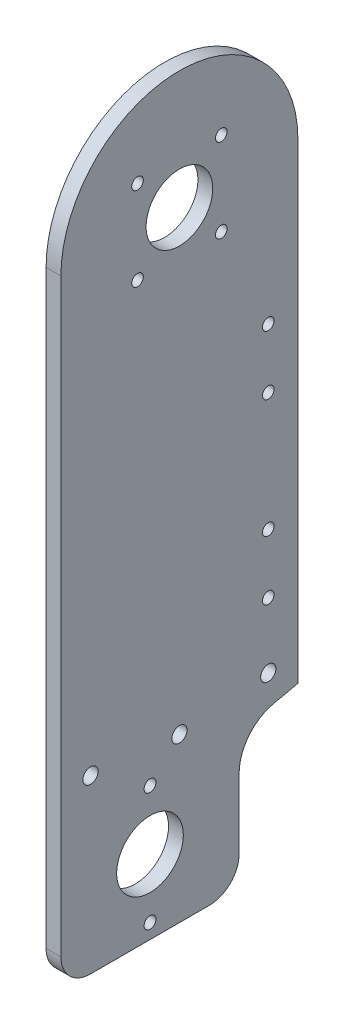
from build123d import *

# Parameters (mm, degrees)
SKETCH1_R                           = 14.2875
BOSS_EXTRUDE1_DEPTH                 = 6.35
F_0_257_DIAMETER_HOLE1_D            = 6.5278
F_9_0_2_DIAMETER_HOLE1_D            = 5.08
FILLET2_R                           = 12.7
FILLET1_R                           = 19.05
F_9_0_196_DIAMETER_HOLE1_AT_2_COUNT = 2
F_9_0_196_DIAMETER_HOLE1_AT_2_PITCH = 25.4
F_9_0_196_DIAMETER_HOLE1_AT_3_COUNT = 2
F_9_0_196_DIAMETER_HOLE1_AT_3_PITCH = 76.2
F_9_0_196_DIAMETER_HOLE1_AT_4_COUNT = 2
F_9_0_196_DIAMETER_HOLE1_AT_4_PITCH = 101.6
F_9_0_196_DIAMETER_HOLE2_OUTLINE_R  = 2.4892
F_9_0_196_DIAMETER_HOLE2_DEPTH      = 6.35


# Read off the part's stored shape, not the designer's step: #9 (0.196) Diameter Hole2
with BuildPart() as part:
    # Sketch1 → Boss-Extrude1 (new body)
    with BuildSketch(Plane.YZ):
        with BuildLine():
            Line((0, -50.8), (-201.989896777, -50.8))
            ThreePointArc((-201.989896777, -50.8), (-204.733971085, -38.269563411), (-206.701492618, -25.593970963))
            Line((-206.701492618, -25.593970963), (-265.489896777, -25.593970963))
            Line((-265.489896777, -25.593970963), (-265.489896777, 50.8))
            Line((-265.489896777, 50.8), (-201.989896777, 50.8))
            Line((-201.989896777, 50.8), (0, 50.8))
            ThreePointArc((0, 50.8), (50.8, 0), (0, -50.8))
        make_face()
        with Locations(Location((0, 0, 0), (0, 0, 270))):
            Circle(SKETCH1_R, mode=Mode.SUBTRACT)
        with Locations(Location((-233.739896777, 12.603014519, 0), (0, 0, 270))):
            Circle(SKETCH1_R, mode=Mode.SUBTRACT)
    extrude(amount=BOSS_EXTRUDE1_DEPTH)

    # F (0.257) Diameter Hole1 (through all)
    with Locations(Plane.YZ.offset(6.35)):
        with Locations((0, 0), (-191.833069099, -38.1), (-195.58, 0), (-191.833069099, 38.1)):
            Hole(F_0_257_DIAMETER_HOLE1_D / 2)

    # #9 (0.2) Diameter Hole1 (through all)
    with Locations(Plane.YZ.offset(6.35)):
        with Locations((-259.139896777, 12.603014519), (-208.339896777, 12.603014519)):
            Hole(F_9_0_2_DIAMETER_HOLE1_D / 2)

    # Fillet2
    fillet2_edges = [part.edges().sort_by_distance(p)[0] for p in [
        (3.175, -265.489896777, -25.593970963),
        (3.175, -265.489896777, 50.8),
    ]]
    fillet(fillet2_edges, radius=FILLET2_R)

    # Fillet1
    fillet1_edges = [part.edges().sort_by_distance(p)[0] for p in [
        (3.175, -206.701492618, -25.593970963),
    ]]
    fillet(fillet1_edges, radius=FILLET1_R)

    # Sketch9 → #9 (0.196) Diameter Hole1 (revolve, cut)
    with BuildSketch(Plane(origin=(6.35, -163.889896777, -38.1), x_dir=(0, 0, -1), z_dir=(0, 1, 0))):
        Polygon((0, 0), (0, 6.35), (4.7625, 6.35), (2.4892, 4.0767), (2.4892, 0), align=None)
    f_9_0_196_diameter_hole1 = revolve(axis=Axis((12.7, -163.889896777, -38.1), (-1, 0, 0)), mode=Mode.SUBTRACT)

    # #9 (0.196) Diameter Hole1 at 2: #9 (0.196) Diameter Hole1 ×2
    with Locations(*[(0, i * F_9_0_196_DIAMETER_HOLE1_AT_2_PITCH, 0) for i in range(1, F_9_0_196_DIAMETER_HOLE1_AT_2_COUNT)]):
        add(f_9_0_196_diameter_hole1, mode=Mode.SUBTRACT)

    # #9 (0.196) Diameter Hole1 at 3: #9 (0.196) Diameter Hole1 ×2
    with Locations(*[(0, i * F_9_0_196_DIAMETER_HOLE1_AT_3_PITCH, 0) for i in range(1, F_9_0_196_DIAMETER_HOLE1_AT_3_COUNT)]):
        add(f_9_0_196_diameter_hole1, mode=Mode.SUBTRACT)

    # #9 (0.196) Diameter Hole1 at 4: #9 (0.196) Diameter Hole1 ×2
    with Locations(*[(0, i * F_9_0_196_DIAMETER_HOLE1_AT_4_PITCH, 0) for i in range(1, F_9_0_196_DIAMETER_HOLE1_AT_4_COUNT)]):
        add(f_9_0_196_diameter_hole1, mode=Mode.SUBTRACT)

    # #9 (0.196) Diameter Hole2 outline → #9 (0.196) Diameter Hole2 (cut)
    with BuildSketch(Plane.YZ):
        with Locations((-17.960512242, -17.960512242)):
            Circle(F_9_0_196_DIAMETER_HOLE2_OUTLINE_R)
        with Locations((17.960512242, -17.960512242)):
            Circle(F_9_0_196_DIAMETER_HOLE2_OUTLINE_R)
        with Locations((17.960512242, 17.960512242)):
            Circle(F_9_0_196_DIAMETER_HOLE2_OUTLINE_R)
        with Locations((-17.960512242, 17.960512242)):
            Circle(F_9_0_196_DIAMETER_HOLE2_OUTLINE_R)
    extrude(amount=F_9_0_196_DIAMETER_HOLE2_DEPTH, mode=Mode.SUBTRACT)


solid = part.part
